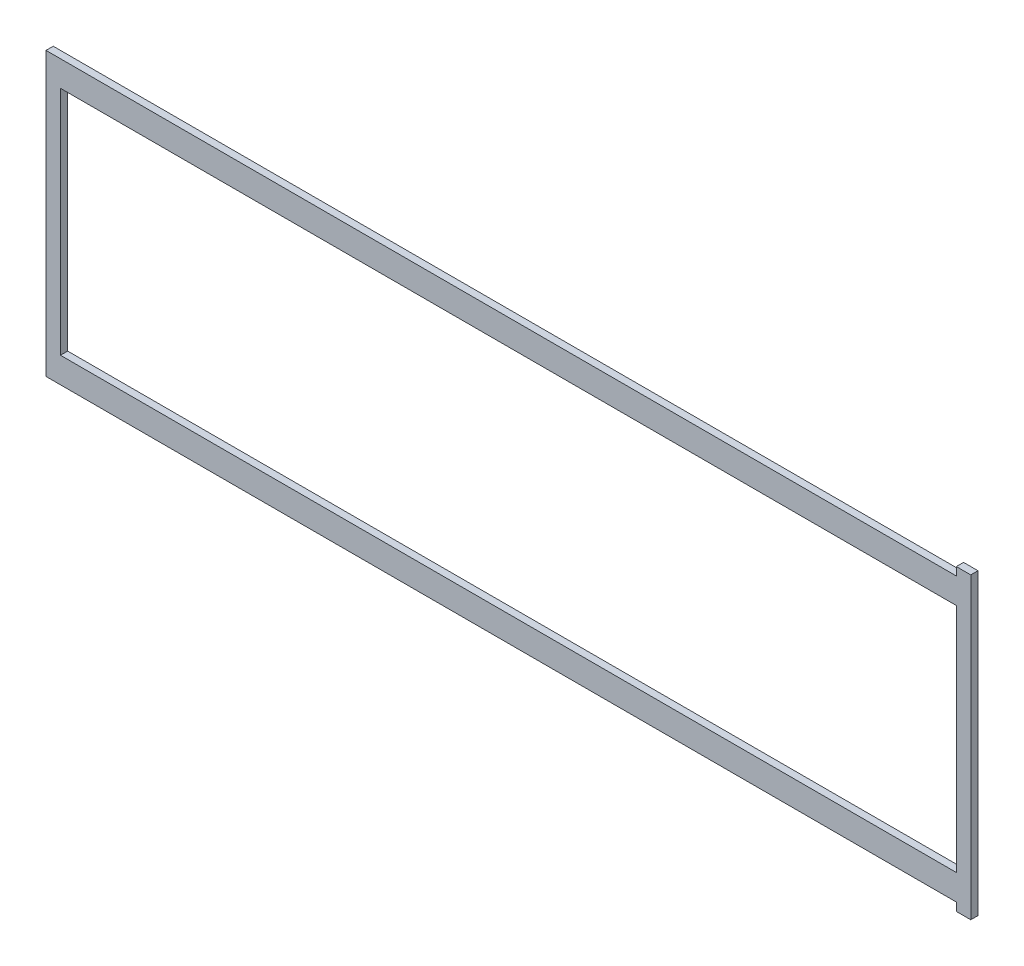
from build123d import *

# Parameters (mm, degrees)
SKETCH1_W           = 393.7
SKETCH1_H           = 101.6
BOSS_EXTRUDE1_DEPTH = 3.175


with BuildPart() as part:
    # Sketch1 → Boss-Extrude1 (new body)
    with BuildSketch(Plane.XY):
        Polygon((0, 124.1044), (0, 0), (400.05, 0), (400.05, -3.5814), (406.4, -3.5814), (406.4, 127.6858), (400.05, 127.6858), (400.05, 124.1044), align=None)
        with Locations((203.2, 62.0522)):
            Rectangle(SKETCH1_W, SKETCH1_H, mode=Mode.SUBTRACT)
    extrude(amount=BOSS_EXTRUDE1_DEPTH)


solid = part.part
